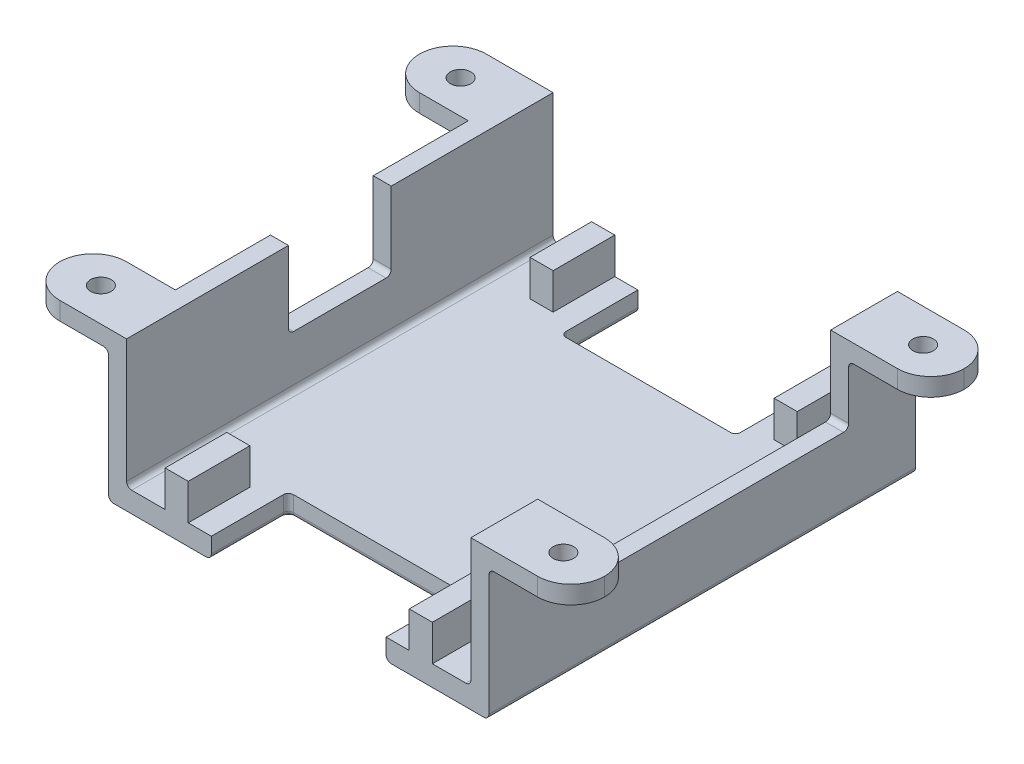
from build123d import *

# Parameters (mm, degrees)
SKETCH1_W                       = 74
SKETCH1_H                       = 53
BOSS_EXTRUDE1_DEPTH             = 4
SKETCH2_W                       = 3.5
SKETCH2_H                       = 53
BOSS_EXTRUDE2_DEPTH             = 25
CUT_EXTRUDE1_REACH              = 85.781
SKETCH3_W                       = 20
SKETCH3_H                       = 15
SKETCH5_W                       = 20
SKETCH5_H                       = 4
BOSS_EXTRUDE4_DEPTH             = 15
MIRROR4_COPY_1_SKETCH_W         = 20
MIRROR4_COPY_1_SKETCH_H         = 4
MIRROR4_COPY_1_DEPTH            = 15
SKETCH6_W                       = 3.5
SKETCH6_H                       = 15
BOSS_EXTRUDE5_DEPTH             = 25
MIRROR6_COPY_1_SKETCH_W         = 3.5
MIRROR6_COPY_1_SKETCH_H         = 15
MIRROR6_COPY_1_DEPTH            = 25
SKETCH7_W                       = 4.5
SKETCH7_H                       = 12
BOSS_EXTRUDE6_DEPTH             = 7
MIRROR8_COPY_1_SKETCH_W         = 4.5
MIRROR8_COPY_1_SKETCH_H         = 12
MIRROR8_COPY_1_DEPTH            = 7
SKETCH8_W                       = 13
SKETCH8_H                       = 3.5
BOSS_EXTRUDE7_DEPTH             = 16
MIRROR10_COPY_1_SKETCH_W        = 13
MIRROR10_COPY_1_SKETCH_H        = 3.5
MIRROR10_COPY_1_DEPTH           = 16
CUT_EXTRUDE2_REACH              = 105.263
SKETCH9_W                       = 57
SKETCH9_H                       = 15
F_4_0MM_CLEARANCE_DOWEL_HOLE1_D = 4
FILLET1_R                       = 6.5
FILLET2_R                       = 1
FILLET3_R                       = 1


with BuildPart() as part:
    # Sketch1 → Boss-Extrude1 (new body)
    with BuildSketch(Plane(origin=(0, 0, 0), x_dir=(1, 0, 0), z_dir=(0, 1, 0))):
        Rectangle(SKETCH1_W, SKETCH1_H)
    extrude(amount=BOSS_EXTRUDE1_DEPTH)

    # Sketch2 → Boss-Extrude2 (add)
    with BuildSketch(Plane(origin=(0, 4, 0), x_dir=(1, 0, 0), z_dir=(0, 1, 0))):
        with Locations((-35.25, 0)):
            Rectangle(SKETCH2_W, SKETCH2_H)
    boss_extrude2 = extrude(amount=BOSS_EXTRUDE2_DEPTH)

    # Mirror1: Boss-Extrude2 across plane
    add(boss_extrude2.mirror(Plane(origin=(0, 0, 0), x_dir=(0, 0, 1), z_dir=(1, 0, 0))))

    # Sketch3 → Cut-Extrude1 (cut, up to next)
    with BuildSketch(Plane.ZY.offset(37), mode=Mode.PRIVATE) as cut_extrude1_sk1:
        with Locations((0, 21.5)):
            Rectangle(SKETCH3_W, SKETCH3_H)
    cut_extrude1_tool1 = extrude(cut_extrude1_sk1.sketch, amount=-CUT_EXTRUDE1_REACH, mode=Mode.PRIVATE) & part.part
    add(cut_extrude1_tool1.solids().sort_by_distance((-37, 21.5, 0))[0], mode=Mode.SUBTRACT)

    # Sketch5 → Boss-Extrude4 (add)
    with BuildSketch(Plane(origin=(0, 0, -26.5), x_dir=(-1, 0, 0), z_dir=(0, 0, -1))):
        with Locations((27, 2)):
            Rectangle(SKETCH5_W, SKETCH5_H)
    boss_extrude4 = extrude(amount=BOSS_EXTRUDE4_DEPTH)

    # Mirror3: Boss-Extrude4 across plane
    add(boss_extrude4.mirror(Plane.XY))

    # Mirror4: Boss-Extrude4 across plane
    add(boss_extrude4.mirror(Plane(origin=(0, 0, 0), x_dir=(0, 0, 1), z_dir=(1, 0, 0))))

    # Mirror4 copy 1 sketch → Mirror4 copy 1 (add)
    with BuildSketch(Plane.XY.offset(26.5)):
        with Locations((27, 2)):
            Rectangle(MIRROR4_COPY_1_SKETCH_W, MIRROR4_COPY_1_SKETCH_H)
    extrude(amount=MIRROR4_COPY_1_DEPTH)

    # Sketch6 → Boss-Extrude5 (add)
    with BuildSketch(Plane(origin=(0, 4, 0), x_dir=(1, 0, 0), z_dir=(0, 1, 0))):
        with Locations((-35.25, 34)):
            Rectangle(SKETCH6_W, SKETCH6_H)
    boss_extrude5 = extrude(amount=BOSS_EXTRUDE5_DEPTH)

    # Mirror5: Boss-Extrude5 across plane
    add(boss_extrude5.mirror(Plane.XY))

    # Mirror6: Boss-Extrude5 across plane
    add(boss_extrude5.mirror(Plane(origin=(0, 0, 0), x_dir=(0, 0, 1), z_dir=(1, 0, 0))))

    # Mirror6 copy 1 sketch → Mirror6 copy 1 (add)
    with BuildSketch(Plane(origin=(0, 4, 0), x_dir=(-1, 0, 0), z_dir=(0, 1, 0))):
        with Locations((-35.25, 34)):
            Rectangle(MIRROR6_COPY_1_SKETCH_W, MIRROR6_COPY_1_SKETCH_H)
    extrude(amount=MIRROR6_COPY_1_DEPTH)

    # Sketch7 → Boss-Extrude6 (add)
    with BuildSketch(Plane(origin=(0, 4, 0), x_dir=(1, 0, 0), z_dir=(0, 1, 0))):
        with Locations((-23.75, 35.5)):
            Rectangle(SKETCH7_W, SKETCH7_H)
    boss_extrude6 = extrude(amount=BOSS_EXTRUDE6_DEPTH)

    # Mirror7: Boss-Extrude6 across plane
    add(boss_extrude6.mirror(Plane.XY))

    # Mirror8: Boss-Extrude6 across plane
    add(boss_extrude6.mirror(Plane(origin=(0, 0, 0), x_dir=(0, 0, 1), z_dir=(1, 0, 0))))

    # Mirror8 copy 1 sketch → Mirror8 copy 1 (add)
    with BuildSketch(Plane(origin=(0, 4, 0), x_dir=(-1, 0, 0), z_dir=(0, 1, 0))):
        with Locations((-23.75, 35.5)):
            Rectangle(MIRROR8_COPY_1_SKETCH_W, MIRROR8_COPY_1_SKETCH_H)
    extrude(amount=MIRROR8_COPY_1_DEPTH)

    # Sketch8 → Boss-Extrude7 (add)
    with BuildSketch(Plane.ZY.offset(37)):
        with Locations((-35, 27.25)):
            Rectangle(SKETCH8_W, SKETCH8_H)
    boss_extrude7 = extrude(amount=BOSS_EXTRUDE7_DEPTH)

    # Mirror9: Boss-Extrude7 across plane
    add(boss_extrude7.mirror(Plane.XY))

    # Mirror10: Boss-Extrude7 across plane
    add(boss_extrude7.mirror(Plane(origin=(0, 0, 0), x_dir=(0, 0, 1), z_dir=(1, 0, 0))))

    # Mirror10 copy 1 sketch → Mirror10 copy 1 (add)
    with BuildSketch(Plane(origin=(37, 0, 0), x_dir=(0, 0, -1), z_dir=(1, 0, 0))):
        with Locations((-35, 27.25)):
            Rectangle(MIRROR10_COPY_1_SKETCH_W, MIRROR10_COPY_1_SKETCH_H)
    extrude(amount=MIRROR10_COPY_1_DEPTH)

    # Sketch9 → Cut-Extrude2 (cut, up to next)
    with BuildSketch(Plane(origin=(37, 0, 0), x_dir=(0, 0, -1), z_dir=(1, 0, 0)), mode=Mode.PRIVATE) as cut_extrude2_sk1:
        with Locations((0, 21.5)):
            Rectangle(SKETCH9_W, SKETCH9_H)
    cut_extrude2_tool1 = extrude(cut_extrude2_sk1.sketch, amount=-CUT_EXTRUDE2_REACH, mode=Mode.PRIVATE) & part.part
    add(cut_extrude2_tool1.solids().sort_by_distance((37, 21.5, 0))[0], mode=Mode.SUBTRACT)

    # Ø4.0mm Clearance Dowel Hole1 (through all)
    with Locations(Plane(origin=(0, 25.5, 0), x_dir=(-1, 0, 0), z_dir=(0, -1, 0))):
        with Locations((-45, 35), (-45, -35), (45, 35), (45, -35)):
            Hole(F_4_0MM_CLEARANCE_DOWEL_HOLE1_D / 2)

    # Fillet1
    # the kernel refuses this fillet: 6.5 mm, written as the material it takes off along each edge
    with BuildSketch(Plane(origin=(53, 45.25, -28.5), x_dir=(0, 0, -1), z_dir=(0, -1, 0)), Plane(origin=(53, 45.25, 28.5), x_dir=(-1, 0, 0), z_dir=(0, -1, 0)), Plane(origin=(53, 9.25, 41.5), x_dir=(-1, 0, 0), z_dir=(0, 1, 0)), Plane(origin=(-53, 9.25, -41.5), x_dir=(1, 0, 0), z_dir=(0, 1, 0)), Plane(origin=(-53, 45.25, -28.5), x_dir=(1, 0, 0), z_dir=(0, -1, 0))) as fillet1_piece_1:
        with BuildLine():
            CenterArc((FILLET1_R, -FILLET1_R), FILLET1_R, 90, 90)
            Line((0, -FILLET1_R), (0, 0))
            Line((0, 0), (FILLET1_R, 0))
        make_face()
    extrude(amount=36, mode=Mode.SUBTRACT)
    with BuildSketch(Plane(origin=(53, 9.25, -41.5), x_dir=(-1, 0, 0), z_dir=(0, 1, 0)), Plane(origin=(-53, 45.25, 28.5), x_dir=(1, 0, 0), z_dir=(0, -1, 0)), Plane(origin=(-53, 9.25, 41.5), x_dir=(1, 0, 0), z_dir=(0, 1, 0))) as fillet1_piece_2:
        with BuildLine():
            CenterArc((FILLET1_R, FILLET1_R), FILLET1_R, 180, 90)
            Line((0, FILLET1_R), (0, 0))
            Line((0, 0), (FILLET1_R, 0))
        make_face()
    extrude(amount=36, mode=Mode.SUBTRACT)

    # Fillet2
    fillet2_edges = [part.edges().sort_by_distance(p)[0] for p in [
        (-33.5, 4, 0),
        (-37, 25.5, -35),
        (-37, 25.5, 35),
        (37, 25.5, 35),
        (37, 25.5, -35),
        (35.25, 14, 28.5),
        (35.25, 14, -28.5),
        (33.5, 4, 0),
        (-35.25, 14, -10),
        (-35.25, 14, 10),
        (-17, 2, -26.5),
        (-17, 2, 26.5),
        (17, 2, 26.5),
        (17, 2, -26.5),
    ]]
    fillet(fillet2_edges, radius=FILLET2_R)

    # Fillet3
    fillet3_edges = [part.edges().sort_by_distance(p)[0] for p in [
        (0, 0, -26.5),
        (0, 0, 26.5),
        (16.707106781, 0, -26.792893219),
        (-16.707106781, 0, -26.792893219),
        (-16.707106781, 0, 26.792893219),
        (16.707106781, 0, 26.792893219),
        (-37, 0, 0),
        (37, 0, 0),
        (-17, 0, -34.5),
        (-17, 0, 34.5),
        (17, 0, 34.5),
        (17, 0, -34.5),
    ]]
    fillet(fillet3_edges, radius=FILLET3_R)


solid = part.part
